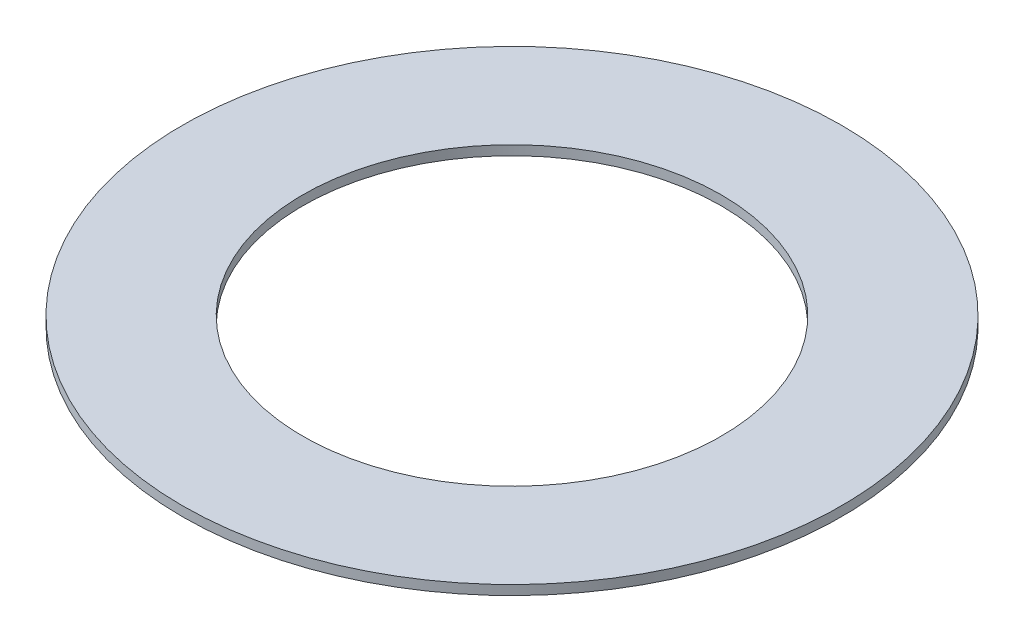
from build123d import *

# Parameters (mm, degrees)
SKETCH1_W = 40
SKETCH1_H = 3.175


with BuildPart() as part:
    # Sketch1 → Revolve1 (revolve)
    with BuildSketch(Plane.XY):
        with Locations((-89.5, 11.3225)):
            Rectangle(SKETCH1_W, SKETCH1_H)
    revolve(axis=Axis((0, -200069.047495165, 0), (0, 1, 0)))


solid = part.part
